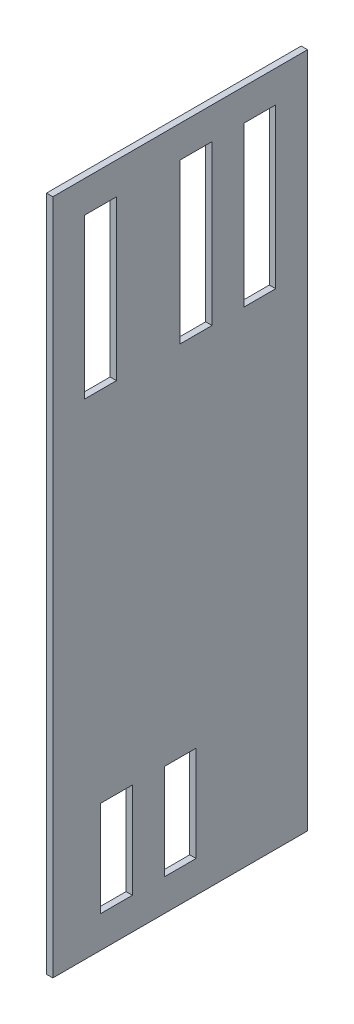
from build123d import *

# Parameters (mm, degrees)
SKETCH1_W          = 80
SKETCH1_H          = 212.4467896
SKETCH1_W_2        = 10
SKETCH1_H_2        = 50
SKETCH1_H_3        = 30
BASE_FLANGE1_DEPTH = 2


# Sheet-metal steps are written as plain solids
with BuildPart() as part:
    # Sketch1 → Base-Flange1 (new body)
    with BuildSketch(Plane(origin=(0, 0, 0), x_dir=(0, 0, -1), z_dir=(1, 0, 0))):
        with Locations((-40, 106.2233948)):
            Rectangle(SKETCH1_W, SKETCH1_H)
        with Locations((-65, 177.4467896)):
            Rectangle(SKETCH1_W_2, SKETCH1_H_2, mode=Mode.SUBTRACT)
        with Locations((-35, 177.4467896)):
            Rectangle(SKETCH1_W_2, SKETCH1_H_2, mode=Mode.SUBTRACT)
        with Locations((-15, 177.4467896)):
            Rectangle(SKETCH1_W_2, SKETCH1_H_2, mode=Mode.SUBTRACT)
        with Locations((-60, 25)):
            Rectangle(SKETCH1_W_2, SKETCH1_H_3, mode=Mode.SUBTRACT)
        with Locations((-40, 25)):
            Rectangle(SKETCH1_W_2, SKETCH1_H_3, mode=Mode.SUBTRACT)
    extrude(amount=-BASE_FLANGE1_DEPTH)


solid = part.part
